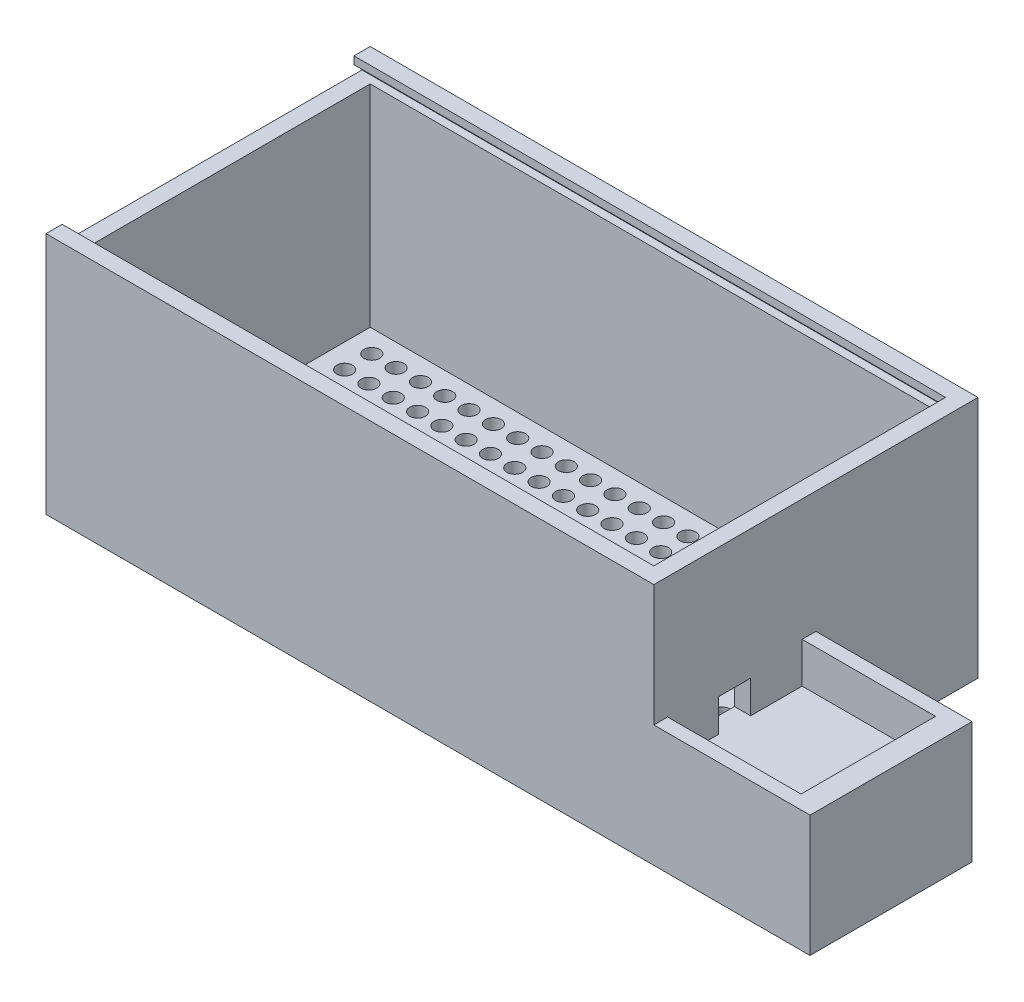
from build123d import *

# Parameters (mm, degrees)
SKETCH1_W           = 190.5
SKETCH1_H           = 101.6
BOSS_EXTRUDE2_DEPTH = 76.2
SKETCH3_W           = 180.34
SKETCH3_H           = 91.44
CUT_EXTRUDE2_DEPTH  = 71.12
SKETCH9_R           = 4.990392266
CUT_EXTRUDE12_DEPTH = 5.08
SKETCH12_R          = 2.458883334
CUT_EXTRUDE13_DEPTH = 7.62
SKETCH5_W           = 48.951164037
SKETCH5_H           = 50.8
BOSS_EXTRUDE4_DEPTH = 38.1
SKETCH13_W          = 41.820402368
SKETCH13_H          = 42.164
CUT_EXTRUDE14_DEPTH = 12.7
CUT_EXTRUDE15_DEPTH = 12.7
CUT_EXTRUDE16_DEPTH = 19.558
SKETCH16_W          = 5.08
SKETCH16_H          = 91.44
CUT_EXTRUDE17_DEPTH = 5.08
SKETCH17_W          = 2.511048621
SKETCH17_H          = 2.687535996
SKETCH17_W_2        = 2.614548726
SKETCH17_H_2        = 2.54
CUT_EXTRUDE18_DEPTH = 185.42


with BuildPart() as part:
    # Sketch1 → Boss-Extrude2 (new body)
    with BuildSketch(Plane(origin=(0, 0, 0), x_dir=(1, 0, 0), z_dir=(0, 1, 0))):
        with Locations((56.510482475, 5.44203176)):
            Rectangle(SKETCH1_W, SKETCH1_H)
    extrude(amount=BOSS_EXTRUDE2_DEPTH)

    # Sketch3 → Cut-Extrude2 (cut)
    with BuildSketch(Plane(origin=(0, 76.2, 0), x_dir=(1, 0, 0), z_dir=(0, 1, 0))):
        with Locations((56.510482475, 5.44203176)):
            Rectangle(SKETCH3_W, SKETCH3_H)
    extrude(amount=-CUT_EXTRUDE2_DEPTH, mode=Mode.SUBTRACT)

    # Sketch9 → Cut-Extrude12 (cut)
    with BuildSketch(Plane(origin=(-33.659517525, 0, 0), x_dir=(0, 0, -1), z_dir=(1, 0, 0))):
        with Locations((-27.885001837, 13.856304681)):
            Circle(SKETCH9_R)
    extrude(amount=-CUT_EXTRUDE12_DEPTH, mode=Mode.SUBTRACT)

    # Sketch12 → Cut-Extrude13 (cut)
    with BuildSketch(Plane.XZ):
        with Locations((-26.039517525, 32.65796824)):
            Circle(SKETCH12_R)
        with Locations((-18.419517525, 32.65796824)):
            Circle(SKETCH12_R)
        with Locations((-10.799517525, 32.65796824)):
            Circle(SKETCH12_R)
        with Locations((-3.179517525, 32.65796824)):
            Circle(SKETCH12_R)
        with Locations((4.440482475, 32.65796824)):
            Circle(SKETCH12_R)
        with Locations((12.060482475, 32.65796824)):
            Circle(SKETCH12_R)
        with Locations((19.680482475, 32.65796824)):
            Circle(SKETCH12_R)
        with Locations((27.300482475, 32.65796824)):
            Circle(SKETCH12_R)
        with Locations((34.920482475, 32.65796824)):
            Circle(SKETCH12_R)
        with Locations((42.540482475, 32.65796824)):
            Circle(SKETCH12_R)
        with Locations((50.160482475, 32.65796824)):
            Circle(SKETCH12_R)
        with Locations((57.780482475, 32.65796824)):
            Circle(SKETCH12_R)
        with Locations((65.400482475, 32.65796824)):
            Circle(SKETCH12_R)
        with Locations((73.020482475, 32.65796824)):
            Circle(SKETCH12_R)
        with Locations((80.640482475, 32.65796824)):
            Circle(SKETCH12_R)
        with Locations((88.260482475, 32.65796824)):
            Circle(SKETCH12_R)
        with Locations((95.880482475, 32.65796824)):
            Circle(SKETCH12_R)
        with Locations((103.500482475, 32.65796824)):
            Circle(SKETCH12_R)
        with Locations((111.120482475, 32.65796824)):
            Circle(SKETCH12_R)
        with Locations((118.740482475, 32.65796824)):
            Circle(SKETCH12_R)
        with Locations((126.360482475, 32.65796824)):
            Circle(SKETCH12_R)
        with Locations((133.980482475, 32.65796824)):
            Circle(SKETCH12_R)
        with Locations((-18.434653532, 24.119525915)):
            Circle(SKETCH12_R)
        with Locations((-10.814653532, 24.119525915)):
            Circle(SKETCH12_R)
        with Locations((-3.194653532, 24.119525915)):
            Circle(SKETCH12_R)
        with Locations((4.425346468, 24.119525915)):
            Circle(SKETCH12_R)
        with Locations((12.045346468, 24.119525915)):
            Circle(SKETCH12_R)
        with Locations((19.665346468, 24.119525915)):
            Circle(SKETCH12_R)
        with Locations((27.285346468, 24.119525915)):
            Circle(SKETCH12_R)
        with Locations((34.905346468, 24.119525915)):
            Circle(SKETCH12_R)
        with Locations((42.525346468, 24.119525915)):
            Circle(SKETCH12_R)
        with Locations((50.145346468, 24.119525915)):
            Circle(SKETCH12_R)
        with Locations((57.765346468, 24.119525915)):
            Circle(SKETCH12_R)
        with Locations((65.385346468, 24.119525915)):
            Circle(SKETCH12_R)
        with Locations((73.005346468, 24.119525915)):
            Circle(SKETCH12_R)
        with Locations((80.625346468, 24.119525915)):
            Circle(SKETCH12_R)
        with Locations((88.245346468, 24.119525915)):
            Circle(SKETCH12_R)
        with Locations((95.865346468, 24.119525915)):
            Circle(SKETCH12_R)
        with Locations((103.485346468, 24.119525915)):
            Circle(SKETCH12_R)
        with Locations((111.105346468, 24.119525915)):
            Circle(SKETCH12_R)
        with Locations((118.725346468, 24.119525915)):
            Circle(SKETCH12_R)
        with Locations((126.345346468, 24.119525915)):
            Circle(SKETCH12_R)
        with Locations((133.965346468, 24.119525915)):
            Circle(SKETCH12_R)
        with Locations((-18.449789539, 15.581083589)):
            Circle(SKETCH12_R)
        with Locations((-10.829789539, 15.581083589)):
            Circle(SKETCH12_R)
        with Locations((-3.209789539, 15.581083589)):
            Circle(SKETCH12_R)
        with Locations((4.410210461, 15.581083589)):
            Circle(SKETCH12_R)
        with Locations((12.030210461, 15.581083589)):
            Circle(SKETCH12_R)
        with Locations((19.650210461, 15.581083589)):
            Circle(SKETCH12_R)
        with Locations((27.270210461, 15.581083589)):
            Circle(SKETCH12_R)
        with Locations((34.890210461, 15.581083589)):
            Circle(SKETCH12_R)
        with Locations((42.510210461, 15.581083589)):
            Circle(SKETCH12_R)
        with Locations((50.130210461, 15.581083589)):
            Circle(SKETCH12_R)
        with Locations((57.750210461, 15.581083589)):
            Circle(SKETCH12_R)
        with Locations((65.370210461, 15.581083589)):
            Circle(SKETCH12_R)
        with Locations((72.990210461, 15.581083589)):
            Circle(SKETCH12_R)
        with Locations((80.610210461, 15.581083589)):
            Circle(SKETCH12_R)
        with Locations((88.230210461, 15.581083589)):
            Circle(SKETCH12_R)
        with Locations((95.850210461, 15.581083589)):
            Circle(SKETCH12_R)
        with Locations((103.470210461, 15.581083589)):
            Circle(SKETCH12_R)
        with Locations((111.090210461, 15.581083589)):
            Circle(SKETCH12_R)
        with Locations((118.710210461, 15.581083589)):
            Circle(SKETCH12_R)
        with Locations((126.330210461, 15.581083589)):
            Circle(SKETCH12_R)
        with Locations((133.950210461, 15.581083589)):
            Circle(SKETCH12_R)
        with Locations((-18.464925547, 7.042641263)):
            Circle(SKETCH12_R)
        with Locations((-10.844925547, 7.042641263)):
            Circle(SKETCH12_R)
        with Locations((-3.224925547, 7.042641263)):
            Circle(SKETCH12_R)
        with Locations((4.395074453, 7.042641263)):
            Circle(SKETCH12_R)
        with Locations((12.015074453, 7.042641263)):
            Circle(SKETCH12_R)
        with Locations((19.635074453, 7.042641263)):
            Circle(SKETCH12_R)
        with Locations((27.255074453, 7.042641263)):
            Circle(SKETCH12_R)
        with Locations((34.875074453, 7.042641263)):
            Circle(SKETCH12_R)
        with Locations((42.495074453, 7.042641263)):
            Circle(SKETCH12_R)
        with Locations((50.115074453, 7.042641263)):
            Circle(SKETCH12_R)
        with Locations((57.735074453, 7.042641263)):
            Circle(SKETCH12_R)
        with Locations((65.355074453, 7.042641263)):
            Circle(SKETCH12_R)
        with Locations((72.975074453, 7.042641263)):
            Circle(SKETCH12_R)
        with Locations((80.595074453, 7.042641263)):
            Circle(SKETCH12_R)
        with Locations((88.215074453, 7.042641263)):
            Circle(SKETCH12_R)
        with Locations((95.835074453, 7.042641263)):
            Circle(SKETCH12_R)
        with Locations((103.455074453, 7.042641263)):
            Circle(SKETCH12_R)
        with Locations((111.075074453, 7.042641263)):
            Circle(SKETCH12_R)
        with Locations((118.695074453, 7.042641263)):
            Circle(SKETCH12_R)
        with Locations((126.315074453, 7.042641263)):
            Circle(SKETCH12_R)
        with Locations((133.935074453, 7.042641263)):
            Circle(SKETCH12_R)
        with Locations((-18.480061554, -1.495801062)):
            Circle(SKETCH12_R)
        with Locations((-10.860061554, -1.495801062)):
            Circle(SKETCH12_R)
        with Locations((-3.240061554, -1.495801062)):
            Circle(SKETCH12_R)
        with Locations((4.379938446, -1.495801062)):
            Circle(SKETCH12_R)
        with Locations((11.999938446, -1.495801062)):
            Circle(SKETCH12_R)
        with Locations((19.619938446, -1.495801062)):
            Circle(SKETCH12_R)
        with Locations((27.239938446, -1.495801062)):
            Circle(SKETCH12_R)
        with Locations((34.859938446, -1.495801062)):
            Circle(SKETCH12_R)
        with Locations((42.479938446, -1.495801062)):
            Circle(SKETCH12_R)
        with Locations((50.099938446, -1.495801062)):
            Circle(SKETCH12_R)
        with Locations((57.719938446, -1.495801062)):
            Circle(SKETCH12_R)
        with Locations((65.339938446, -1.495801062)):
            Circle(SKETCH12_R)
        with Locations((72.959938446, -1.495801062)):
            Circle(SKETCH12_R)
        with Locations((80.579938446, -1.495801062)):
            Circle(SKETCH12_R)
        with Locations((88.199938446, -1.495801062)):
            Circle(SKETCH12_R)
        with Locations((95.819938446, -1.495801062)):
            Circle(SKETCH12_R)
        with Locations((103.439938446, -1.495801062)):
            Circle(SKETCH12_R)
        with Locations((111.059938446, -1.495801062)):
            Circle(SKETCH12_R)
        with Locations((118.679938446, -1.495801062)):
            Circle(SKETCH12_R)
        with Locations((126.299938446, -1.495801062)):
            Circle(SKETCH12_R)
        with Locations((133.919938446, -1.495801062)):
            Circle(SKETCH12_R)
        with Locations((-18.495197562, -10.034243388)):
            Circle(SKETCH12_R)
        with Locations((-10.875197562, -10.034243388)):
            Circle(SKETCH12_R)
        with Locations((-3.255197562, -10.034243388)):
            Circle(SKETCH12_R)
        with Locations((4.364802438, -10.034243388)):
            Circle(SKETCH12_R)
        with Locations((11.984802438, -10.034243388)):
            Circle(SKETCH12_R)
        with Locations((19.604802438, -10.034243388)):
            Circle(SKETCH12_R)
        with Locations((27.224802438, -10.034243388)):
            Circle(SKETCH12_R)
        with Locations((34.844802438, -10.034243388)):
            Circle(SKETCH12_R)
        with Locations((42.464802438, -10.034243388)):
            Circle(SKETCH12_R)
        with Locations((50.084802438, -10.034243388)):
            Circle(SKETCH12_R)
        with Locations((57.704802438, -10.034243388)):
            Circle(SKETCH12_R)
        with Locations((65.324802438, -10.034243388)):
            Circle(SKETCH12_R)
        with Locations((72.944802438, -10.034243388)):
            Circle(SKETCH12_R)
        with Locations((80.564802438, -10.034243388)):
            Circle(SKETCH12_R)
        with Locations((88.184802438, -10.034243388)):
            Circle(SKETCH12_R)
        with Locations((95.804802438, -10.034243388)):
            Circle(SKETCH12_R)
        with Locations((103.424802438, -10.034243388)):
            Circle(SKETCH12_R)
        with Locations((111.044802438, -10.034243388)):
            Circle(SKETCH12_R)
        with Locations((118.664802438, -10.034243388)):
            Circle(SKETCH12_R)
        with Locations((126.284802438, -10.034243388)):
            Circle(SKETCH12_R)
        with Locations((133.904802438, -10.034243388)):
            Circle(SKETCH12_R)
        with Locations((-18.510333569, -18.572685714)):
            Circle(SKETCH12_R)
        with Locations((-10.890333569, -18.572685714)):
            Circle(SKETCH12_R)
        with Locations((-3.270333569, -18.572685714)):
            Circle(SKETCH12_R)
        with Locations((4.349666431, -18.572685714)):
            Circle(SKETCH12_R)
        with Locations((11.969666431, -18.572685714)):
            Circle(SKETCH12_R)
        with Locations((19.589666431, -18.572685714)):
            Circle(SKETCH12_R)
        with Locations((27.209666431, -18.572685714)):
            Circle(SKETCH12_R)
        with Locations((34.829666431, -18.572685714)):
            Circle(SKETCH12_R)
        with Locations((42.449666431, -18.572685714)):
            Circle(SKETCH12_R)
        with Locations((50.069666431, -18.572685714)):
            Circle(SKETCH12_R)
        with Locations((57.689666431, -18.572685714)):
            Circle(SKETCH12_R)
        with Locations((65.309666431, -18.572685714)):
            Circle(SKETCH12_R)
        with Locations((72.929666431, -18.572685714)):
            Circle(SKETCH12_R)
        with Locations((80.549666431, -18.572685714)):
            Circle(SKETCH12_R)
        with Locations((88.169666431, -18.572685714)):
            Circle(SKETCH12_R)
        with Locations((95.789666431, -18.572685714)):
            Circle(SKETCH12_R)
        with Locations((103.409666431, -18.572685714)):
            Circle(SKETCH12_R)
        with Locations((111.029666431, -18.572685714)):
            Circle(SKETCH12_R)
        with Locations((118.649666431, -18.572685714)):
            Circle(SKETCH12_R)
        with Locations((126.269666431, -18.572685714)):
            Circle(SKETCH12_R)
        with Locations((133.889666431, -18.572685714)):
            Circle(SKETCH12_R)
        with Locations((-18.525469576, -27.111128039)):
            Circle(SKETCH12_R)
        with Locations((-10.905469576, -27.111128039)):
            Circle(SKETCH12_R)
        with Locations((-3.285469576, -27.111128039)):
            Circle(SKETCH12_R)
        with Locations((4.334530424, -27.111128039)):
            Circle(SKETCH12_R)
        with Locations((11.954530424, -27.111128039)):
            Circle(SKETCH12_R)
        with Locations((19.574530424, -27.111128039)):
            Circle(SKETCH12_R)
        with Locations((27.194530424, -27.111128039)):
            Circle(SKETCH12_R)
        with Locations((34.814530424, -27.111128039)):
            Circle(SKETCH12_R)
        with Locations((42.434530424, -27.111128039)):
            Circle(SKETCH12_R)
        with Locations((50.054530424, -27.111128039)):
            Circle(SKETCH12_R)
        with Locations((57.674530424, -27.111128039)):
            Circle(SKETCH12_R)
        with Locations((65.294530424, -27.111128039)):
            Circle(SKETCH12_R)
        with Locations((72.914530424, -27.111128039)):
            Circle(SKETCH12_R)
        with Locations((80.534530424, -27.111128039)):
            Circle(SKETCH12_R)
        with Locations((88.154530424, -27.111128039)):
            Circle(SKETCH12_R)
        with Locations((95.774530424, -27.111128039)):
            Circle(SKETCH12_R)
        with Locations((103.394530424, -27.111128039)):
            Circle(SKETCH12_R)
        with Locations((111.014530424, -27.111128039)):
            Circle(SKETCH12_R)
        with Locations((118.634530424, -27.111128039)):
            Circle(SKETCH12_R)
        with Locations((126.254530424, -27.111128039)):
            Circle(SKETCH12_R)
        with Locations((133.874530424, -27.111128039)):
            Circle(SKETCH12_R)
        with Locations((-18.540605584, -35.649570365)):
            Circle(SKETCH12_R)
        with Locations((-10.920605584, -35.649570365)):
            Circle(SKETCH12_R)
        with Locations((-3.300605584, -35.649570365)):
            Circle(SKETCH12_R)
        with Locations((4.319394416, -35.649570365)):
            Circle(SKETCH12_R)
        with Locations((11.939394416, -35.649570365)):
            Circle(SKETCH12_R)
        with Locations((19.559394416, -35.649570365)):
            Circle(SKETCH12_R)
        with Locations((27.179394416, -35.649570365)):
            Circle(SKETCH12_R)
        with Locations((34.799394416, -35.649570365)):
            Circle(SKETCH12_R)
        with Locations((42.419394416, -35.649570365)):
            Circle(SKETCH12_R)
        with Locations((50.039394416, -35.649570365)):
            Circle(SKETCH12_R)
        with Locations((57.659394416, -35.649570365)):
            Circle(SKETCH12_R)
        with Locations((65.279394416, -35.649570365)):
            Circle(SKETCH12_R)
        with Locations((72.899394416, -35.649570365)):
            Circle(SKETCH12_R)
        with Locations((80.519394416, -35.649570365)):
            Circle(SKETCH12_R)
        with Locations((88.139394416, -35.649570365)):
            Circle(SKETCH12_R)
        with Locations((95.759394416, -35.649570365)):
            Circle(SKETCH12_R)
        with Locations((103.379394416, -35.649570365)):
            Circle(SKETCH12_R)
        with Locations((110.999394416, -35.649570365)):
            Circle(SKETCH12_R)
        with Locations((118.619394416, -35.649570365)):
            Circle(SKETCH12_R)
        with Locations((126.239394416, -35.649570365)):
            Circle(SKETCH12_R)
        with Locations((133.859394416, -35.649570365)):
            Circle(SKETCH12_R)
        with Locations((-18.555741591, -44.188012691)):
            Circle(SKETCH12_R)
        with Locations((-10.935741591, -44.188012691)):
            Circle(SKETCH12_R)
        with Locations((-3.315741591, -44.188012691)):
            Circle(SKETCH12_R)
        with Locations((4.304258409, -44.188012691)):
            Circle(SKETCH12_R)
        with Locations((11.924258409, -44.188012691)):
            Circle(SKETCH12_R)
        with Locations((19.544258409, -44.188012691)):
            Circle(SKETCH12_R)
        with Locations((27.164258409, -44.188012691)):
            Circle(SKETCH12_R)
        with Locations((34.784258409, -44.188012691)):
            Circle(SKETCH12_R)
        with Locations((42.404258409, -44.188012691)):
            Circle(SKETCH12_R)
        with Locations((50.024258409, -44.188012691)):
            Circle(SKETCH12_R)
        with Locations((57.644258409, -44.188012691)):
            Circle(SKETCH12_R)
        with Locations((65.264258409, -44.188012691)):
            Circle(SKETCH12_R)
        with Locations((72.884258409, -44.188012691)):
            Circle(SKETCH12_R)
        with Locations((80.504258409, -44.188012691)):
            Circle(SKETCH12_R)
        with Locations((88.124258409, -44.188012691)):
            Circle(SKETCH12_R)
        with Locations((95.744258409, -44.188012691)):
            Circle(SKETCH12_R)
        with Locations((103.364258409, -44.188012691)):
            Circle(SKETCH12_R)
        with Locations((110.984258409, -44.188012691)):
            Circle(SKETCH12_R)
        with Locations((118.604258409, -44.188012691)):
            Circle(SKETCH12_R)
        with Locations((126.224258409, -44.188012691)):
            Circle(SKETCH12_R)
        with Locations((133.844258409, -44.188012691)):
            Circle(SKETCH12_R)
        with Locations((-26.054653532, 24.119525915)):
            Circle(SKETCH12_R)
        with Locations((-26.069789539, 15.581083589)):
            Circle(SKETCH12_R)
        with Locations((-26.084925547, 7.042641263)):
            Circle(SKETCH12_R)
        with Locations((-26.100061554, -1.495801062)):
            Circle(SKETCH12_R)
        with Locations((-26.115197562, -10.034243388)):
            Circle(SKETCH12_R)
        with Locations((-26.130333569, -18.572685714)):
            Circle(SKETCH12_R)
        with Locations((-26.145469576, -27.111128039)):
            Circle(SKETCH12_R)
        with Locations((-26.160605584, -35.649570365)):
            Circle(SKETCH12_R)
        with Locations((-26.175741591, -44.188012691)):
            Circle(SKETCH12_R)
    extrude(amount=-CUT_EXTRUDE13_DEPTH, mode=Mode.SUBTRACT)

    # Sketch5 → Boss-Extrude4 (add)
    with BuildSketch(Plane.XZ):
        with Locations((176.236064494, 19.95796824)):
            Rectangle(SKETCH5_W, SKETCH5_H)
    extrude(amount=-BOSS_EXTRUDE4_DEPTH)

    # Sketch13 → Cut-Extrude14 (cut)
    with BuildSketch(Plane(origin=(0, 38.1, 0), x_dir=(1, 0, 0), z_dir=(0, 1, 0))):
        with Locations((172.670683659, -19.95796824)):
            Rectangle(SKETCH13_W, SKETCH13_H)
    extrude(amount=-CUT_EXTRUDE14_DEPTH, mode=Mode.SUBTRACT)

    # Sketch14 → Cut-Extrude15 (cut)
    with BuildSketch(Plane(origin=(151.760482475, 0, 0), x_dir=(0, 0, -1), z_dir=(1, 0, 0))):
        Polygon((-19.95796824, 25.4), (-15.004359374, 25.4), (-15.004359374, 35.631586661), (-25.091396465, 35.631586661), (-25.091396465, 25.4), align=None)
    extrude(amount=-CUT_EXTRUDE15_DEPTH, mode=Mode.SUBTRACT)

    # Sketch15 → Cut-Extrude16 (cut)
    with BuildSketch(Plane(origin=(-33.659517525, 0, 0), x_dir=(0, 0, -1), z_dir=(1, 0, 0))):
        Polygon((-17.665268705, 21.502907935), (3.334731295, 21.502907935), (3.334731295, 6.356304681), (-17.665268705, 6.356304681), (-17.665268705, 13.856304681), align=None)
    extrude(amount=-CUT_EXTRUDE16_DEPTH, mode=Mode.SUBTRACT)

    # Sketch16 → Cut-Extrude17 (cut)
    with BuildSketch(Plane(origin=(0, 76.2, 0), x_dir=(1, 0, 0), z_dir=(0, 1, 0))):
        with Locations((-36.199517525, 5.44203176)):
            Rectangle(SKETCH16_W, SKETCH16_H)
    extrude(amount=-CUT_EXTRUDE17_DEPTH, mode=Mode.SUBTRACT)

    # Sketch17 → Cut-Extrude18 (cut)
    with BuildSketch(Plane.ZY.offset(38.739517525)):
        with Locations((-52.417556071, 72.463767998)):
            Rectangle(SKETCH17_W, SKETCH17_H)
        with Locations((41.585242603, 72.39)):
            Rectangle(SKETCH17_W_2, SKETCH17_H_2)
    extrude(amount=-CUT_EXTRUDE18_DEPTH, mode=Mode.SUBTRACT)


solid = part.part
